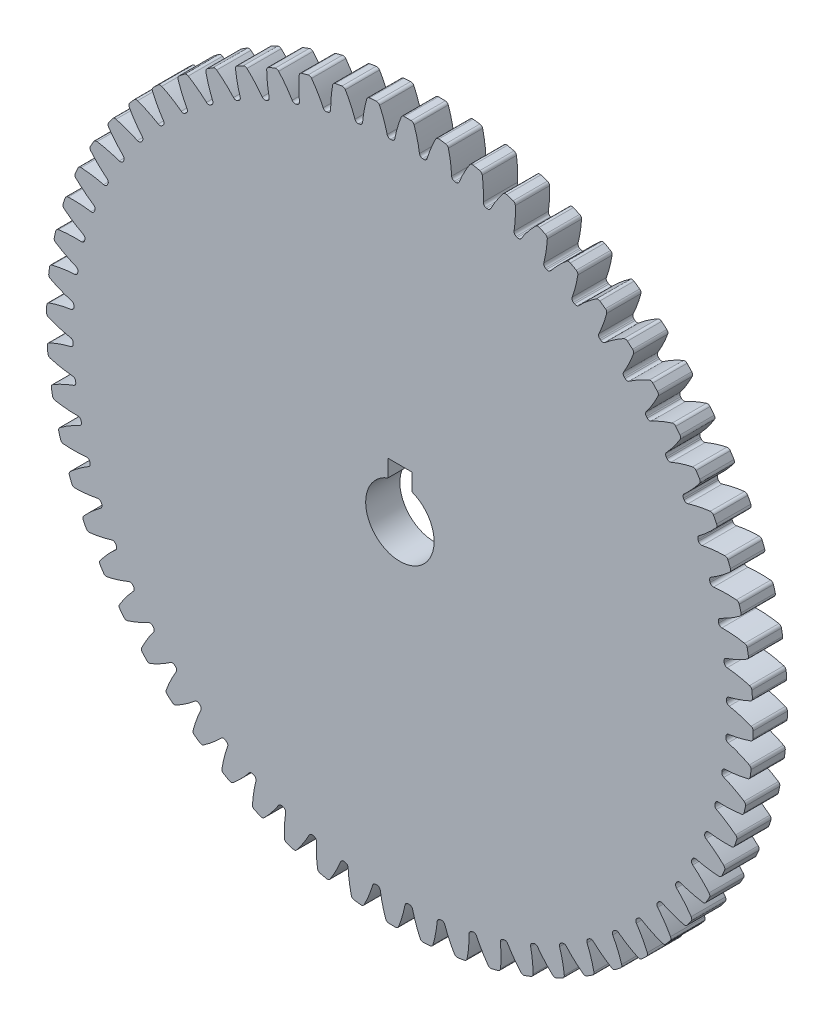
from build123d import *

# Parameters (mm, degrees)
SALIENTE_EXTRUIR1_DEPTH = 10
REDONDEO1_R             = 0.9525
MATRIZC1_DEPTH          = 10
CORTAR_EXTRUIR3_REACH   = 148.313


with BuildPart() as part:
    # Croquis2 → Saliente-Extruir1 (new body)
    with BuildSketch(Plane.XY):
        with BuildLine():
            ThreePointArc((-1.617609279, 95.459065591), (-2.108928891, -95.449475024), (5.832254015, 95.29446299))
            ThreePointArc((5.832254015, 95.29446299), (5.10661393, 99.278185867), (3.922472554, 103.150447571))
            ThreePointArc((3.922472554, 103.150447571), (2.2801704, 103.199813217), (0.637290554, 103.223032729))
            ThreePointArc((0.637290554, 103.223032729), (-0.716724786, 99.406850873), (-1.617609279, 95.459065591))
        make_face()
    extrude(amount=SALIENTE_EXTRUIR1_DEPTH)

    # Redondeo1
    redondeo1_edges = [part.edges().sort_by_distance(p)[0] for p in [
        (5.832254015, 95.29446299, 5),
        (-1.617609279, 95.459065591, 5),
        (0.637290554, 103.223032729, 5),
        (3.922472554, 103.150447571, 5),
    ]]
    fillet(redondeo1_edges, radius=REDONDEO1_R)

    # MatrizC1: read off the stored shape, not the designer's step
    # MatrizC1 outline → MatrizC1 (add)
    with BuildSketch(Plane.XY):
        with BuildLine():
            ThreePointArc((-10.905729372, 95.608172375), (-11.169760561, 95.031575012), (-11.737272301, 94.748542481))
            ThreePointArc((-11.737272301, 94.748542481), (-7.256910766, 95.196570892), (-2.760407872, 95.432856039))
            ThreePointArc((-2.760407872, 95.432856039), (-3.364264227, 95.626594242), (-3.712645561, 96.156506909))
            ThreePointArc((-3.712645561, 96.156506909), (-4.668126939, 99.355349151), (-5.926168915, 102.447737668))
            ThreePointArc((-5.926168915, 102.447737668), (-6.304598673, 102.866263261), (-6.853432254, 102.99723827))
            ThreePointArc((-6.853432254, 102.99723827), (-7.846159818, 102.926373691), (-8.838158, 102.845941039))
            ThreePointArc((-8.838158, 102.845941039), (-9.360796454, 102.633286859), (-9.671412988, 102.162234716))
            ThreePointArc((-9.671412988, 102.162234716), (-10.446171584, 98.914884185), (-10.905729372, 95.608172375))
        make_face()
        with BuildLine():
            ThreePointArc((6.972779758, 95.217804038), (11.45445841, 94.783148533), (15.910659207, 94.13766933))
            ThreePointArc((15.910659207, 94.13766933), (15.356202231, 94.445491439), (15.117895779, 95.033187809))
            ThreePointArc((15.117895779, 95.033187809), (14.804836871, 98.356970365), (14.17426289, 101.635371318))
            ThreePointArc((14.17426289, 101.635371318), (13.884754847, 102.119683042), (13.372018906, 102.355213523))
            ThreePointArc((13.372018906, 102.355213523), (12.38454133, 102.479382127), (11.395912483, 102.59402421))
            ThreePointArc((11.395912483, 102.59402421), (10.841829608, 102.487417825), (10.445283769, 102.086015097))
            ThreePointArc((10.445283769, 102.086015097), (9.051885281, 99.0522094), (7.956050296, 95.898690407))
            ThreePointArc((7.956050296, 95.898690407), (7.584603826, 95.38468213), (6.972779758, 95.217804038))
        make_face()
        with BuildLine():
            ThreePointArc((16.272180778, 94.075852353), (20.689675232, 93.204008508), (25.061150179, 92.124853405))
            ThreePointArc((25.061150179, 92.124853405), (24.539534908, 92.485539554), (24.359980284, 93.093764123))
            ThreePointArc((24.359980284, 93.093764123), (24.374216501, 96.432226895), (24.068018393, 99.75664851))
            ThreePointArc((24.068018393, 99.75664851), (23.827375261, 100.267004892), (23.340194307, 100.55165814))
            ThreePointArc((23.340194307, 100.55165814), (22.369642357, 100.772018566), (21.397010918, 100.983011189))
            ThreePointArc((21.397010918, 100.983011189), (20.835146851, 100.931227762), (20.40116614, 100.570626186))
            ThreePointArc((20.40116614, 100.570626186), (18.717112288, 97.688006028), (17.317455134, 94.657082702))
            ThreePointArc((17.317455134, 94.657082702), (16.89741566, 94.181957636), (16.272180778, 94.075852353))
        make_face()
        with BuildLine():
            ThreePointArc((25.414871801, 92.027898783), (29.725639171, 90.727262931), (33.970288574, 89.224824781))
            ThreePointArc((33.970288574, 89.224824781), (33.486538449, 89.634901366), (33.367464863, 90.257796597))
            ThreePointArc((33.367464863, 90.257796597), (33.708859103, 93.578788366), (33.729985722, 96.917214645))
            ThreePointArc((33.729985722, 96.917214645), (33.540525025, 97.448700673), (33.083590878, 97.779735322))
            ThreePointArc((33.083590878, 97.779735322), (32.1393115, 98.094165378), (31.19204444, 98.399476567))
            ThreePointArc((31.19204444, 98.399476567), (30.627810239, 98.4030148), (30.160574129, 98.086687168))
            ThreePointArc((30.160574129, 98.086687168), (28.202083272, 95.383013756), (26.512083413, 92.503875547))
            ThreePointArc((26.512083413, 92.503875547), (26.047496143, 92.072209406), (25.414871801, 92.027898783))
        make_face()
        with BuildLine():
            ThreePointArc((34.312803716, 89.09366624), (38.475328957, 87.376764215), (42.552274521, 85.465512319))
            ThreePointArc((42.552274521, 85.465512319), (42.111048319, 85.921030078), (42.053602514, 86.552597151))
            ThreePointArc((42.053602514, 86.552597151), (42.718866964, 89.82413495), (43.067114849, 93.144415023))
            ThreePointArc((43.067114849, 93.144415023), (42.930661198, 93.691912196), (42.508374384, 94.066140201))
            ThreePointArc((42.508374384, 94.066140201), (41.599461504, 94.471611755), (40.686681524, 94.868301195))
            ThreePointArc((40.686681524, 94.868301195), (40.125511072, 94.927127013), (39.629519301, 94.658119733))
            ThreePointArc((39.629519301, 94.658119733), (37.415452777, 92.15943092), (35.451385835, 89.459805502))
            ThreePointArc((35.451385835, 89.459805502), (34.946724999, 89.075755467), (34.312803716, 89.09366624))
        make_face()
        with BuildLine():
            ThreePointArc((42.880284574, 85.301412988), (46.854480291, 83.184779494), (50.724458803, 80.883120254))
            ThreePointArc((50.724458803, 80.883120254), (50.330005774, 81.379692301), (50.334740985, 82.013848879))
            ThreePointArc((50.334740985, 82.013848879), (51.317468783, 85.20442601), (51.989484118, 88.474583765))
            ThreePointArc((51.989484118, 88.474583765), (51.907351636, 89.032819387), (51.523779007, 89.446636728))
            ThreePointArc((51.523779007, 89.446636728), (50.658985953, 89.939244867), (49.789483623, 90.423492222))
            ThreePointArc((49.789483623, 90.423492222), (49.236781298, 90.537039101), (48.716810539, 90.317942859))
            ThreePointArc((48.716810539, 90.317942859), (46.268491018, 88.048302385), (44.049272032, 85.554188626))
            ThreePointArc((44.049272032, 85.554188626), (43.50939779, 85.221453309), (42.880284574, 85.301412988))
        make_face()
        with BuildLine():
            ThreePointArc((51.03480485, 80.687660499), (54.782397366, 78.191679875), (58.408138817, 75.521779525))
            ThreePointArc((58.408138817, 75.521779525), (58.06425776, 76.0546236), (58.131128383, 76.68526241))
            ThreePointArc((58.131128383, 76.68526241), (59.421855326, 79.764151871), (60.411166235, 82.952693902))
            ThreePointArc((60.411166235, 82.952693902), (60.384145902, 83.516291857), (60.042981472, 83.965713246))
            ThreePointArc((60.042981472, 83.965713246), (59.230636675, 84.540713885), (58.412785776, 85.107855588))
            ThreePointArc((58.412785776, 85.107855588), (57.873874405, 85.27503001), (57.33493226, 85.107954823))
            ThreePointArc((57.33493226, 85.107954823), (54.675938398, 83.089220566), (52.22293966, 80.824638145))
            ThreePointArc((52.22293966, 80.824638145), (51.653051295, 80.546421969), (51.03480485, 80.687660499))
        make_face()
        with BuildLine():
            ThreePointArc((58.697832057, 75.29684173), (62.182730008, 72.445551633), (65.529316526, 69.433122775))
            ThreePointArc((65.529316526, 69.433122775), (65.239319202, 69.997107299), (65.367681238, 70.618154943))
            ThreePointArc((65.367681238, 70.618154943), (66.953976918, 73.555705346), (68.251055796, 76.631924249))
            ThreePointArc((68.251055796, 76.631924249), (68.279407833, 77.195456782), (67.983937203, 77.676154046))
            ThreePointArc((67.983937203, 77.676154046), (67.231863986, 78.328009613), (66.473540871, 78.972583781))
            ThreePointArc((66.473540871, 78.972583781), (65.953610464, 79.191775763), (65.400887241, 79.078330657))
            ThreePointArc((65.400887241, 79.078330657), (62.556826603, 77.329944132), (59.89367183, 75.316702216))
            ThreePointArc((59.89367183, 75.316702216), (59.29925768, 75.095684555), (58.697832057, 75.29684173))
        make_face()
        with BuildLine():
            ThreePointArc((65.795567054, 69.180873215), (68.984208967, 66.001733127), (72.019411094, 62.675787097))
            ThreePointArc((72.019411094, 62.675787097), (71.786090337, 63.26548059), (71.974707589, 63.87095604))
            ThreePointArc((71.974707589, 63.87095604), (73.841295111, 66.638877169), (75.43365038, 69.573147274))
            ThreePointArc((75.43365038, 69.573147274), (75.517101742, 70.131187258), (75.270170455, 70.63853102))
            ThreePointArc((75.270170455, 70.63853102), (74.585611695, 71.360963791), (73.89411943, 72.076762821))
            ThreePointArc((73.89411943, 72.076762821), (73.398177201, 72.345861426), (72.836995926, 72.287138938))
            ThreePointArc((72.836995926, 72.287138938), (69.83525837, 70.825938063), (66.9875952, 69.083425272))
            ThreePointArc((66.9875952, 69.083425272), (66.374379797, 68.921734646), (65.795567054, 69.180873215))
        make_face()
        with BuildLine():
            ThreePointArc((72.259654772, 62.398655072), (75.121332283, 58.922281852), (77.815919363, 55.314849328))
            ThreePointArc((77.815919363, 55.314849328), (77.64152218, 55.924572719), (77.888578161, 56.508644915))
            ThreePointArc((77.888578161, 56.508644915), (80.017481267, 59.080280176), (81.889777675, 61.844342859))
            ThreePointArc((81.889777675, 61.844342859), (82.027524679, 62.391516064), (81.831510818, 62.920620326))
            ThreePointArc((81.831510818, 62.920620326), (81.22105919, 63.706672877), (80.603057223, 64.486803234))
            ThreePointArc((80.603057223, 64.486803234), (80.135879367, 64.803216894), (79.571644524, 64.799782555))
            ThreePointArc((79.571644524, 64.799782555), (76.441138423, 63.639839493), (73.436391409, 62.184837178))
            ThreePointArc((73.436391409, 62.184837178), (72.810280353, 62.084030757), (72.259654772, 62.398655072))
        make_face()
        with BuildLine():
            ThreePointArc((78.027842514, 55.01550377), (80.534996104, 51.275376791), (82.863017791, 47.421199321))
            ThreePointArc((82.863017791, 47.421199321), (82.749223721, 48.04508064), (83.052339146, 48.602124649))
            ThreePointArc((83.052339146, 48.602124649), (85.423055337, 50.952707788), (87.557261645, 53.519943615))
            ThreePointArc((87.557261645, 53.519943615), (87.747977713, 54.050980464), (87.604768999, 54.596749662))
            ThreePointArc((87.604768999, 54.596749662), (87.074303485, 55.438851878), (86.535743513, 56.275800479))
            ThreePointArc((86.535743513, 56.275800479), (86.101829209, 56.636481959), (85.539974686, 56.688368843))
            ThreePointArc((85.539974686, 56.688368843), (82.310848526, 55.840854479), (79.177955024, 54.687375108))
            ThreePointArc((79.177955024, 54.687375108), (78.544978107, 54.648423713), (78.027842514, 55.01550377))
        make_face()
        with BuildLine():
            ThreePointArc((83.044579479, 47.102523093), (85.173063887, 43.134661822), (87.11210006, 39.070857242))
            ThreePointArc((87.11210006, 39.070857242), (87.060005003, 39.702888171), (87.416260705, 40.227539353))
            ThreePointArc((87.416260705, 40.227539353), (90.005958686, 42.334432971), (92.381521322, 44.680118056))
            ThreePointArc((92.381521322, 44.680118056), (92.623369753, 45.189904374), (92.534345365, 45.747082453))
            ThreePointArc((92.534345365, 45.747082453), (92.088974638, 46.63712443), (91.635043289, 47.522831003))
            ThreePointArc((91.635043289, 47.522831003), (91.238571367, 47.924306742), (90.684508131, 48.03101515))
            ThreePointArc((90.684508131, 48.03101515), (87.387860162, 47.504091512), (84.156991649, 46.663243721))
            ThreePointArc((84.156991649, 46.663243721), (83.523244785, 46.686522474), (83.044579479, 47.102523093))
        make_face()
        with BuildLine():
            ThreePointArc((87.261551746, 38.735919369), (88.990868505, 34.57853648), (90.522245185, 30.344241449))
            ThreePointArc((90.522245185, 30.344241449), (90.532350844, 30.978335185), (90.938315886, 31.465540864))
            ThreePointArc((90.938315886, 31.465540864), (93.722055452, 33.308454422), (96.316096448, 35.409998536))
            ThreePointArc((96.316096448, 35.409998536), (96.60674811, 35.893624802), (96.5727654, 36.456845832))
            ThreePointArc((96.5727654, 36.456845832), (96.216778625, 37.386255978), (95.851847504, 38.312190685))
            ThreePointArc((95.851847504, 38.312190685), (95.496636207, 38.750594252), (94.95570019, 38.911096524))
            ThreePointArc((94.95570019, 38.911096524), (91.623278934, 38.709838174), (88.32555044, 38.189719787))
            ThreePointArc((88.32555044, 38.189719787), (87.697136957, 38.275004503), (87.261551746, 38.735919369))
        make_face()
        with BuildLine():
            ThreePointArc((90.638147567, 29.996267567), (91.951642412, 25.68940093), (93.060611604, 21.325394024))
            ThreePointArc((93.060611604, 21.325394024), (93.132820657, 21.955443897), (93.584585373, 22.400512014))
            ThreePointArc((93.584585373, 22.400512014), (96.535557589, 23.961697249), (99.323094914, 25.798861373))
            ThreePointArc((99.323094914, 25.798861373), (99.659750672, 26.251670001), (99.681136912, 26.815509856))
            ThreePointArc((99.681136912, 26.815509856), (99.417962436, 27.775337444), (99.14554603, 28.732583027))
            ThreePointArc((99.14554603, 28.732583027), (98.835016237, 29.203692357), (98.312416948, 29.416442768))
            ThreePointArc((98.312416948, 29.416442768), (94.976315443, 29.542787934), (91.643485897, 29.348407976))
            ThreePointArc((91.643485897, 29.348407976), (91.02645776, 29.494877315), (90.638147567, 29.996267567))
        make_face()
        with BuildLine():
            ThreePointArc((93.14184848, 20.967735311), (94.026871737, 16.552862404), (94.702753462, 12.101171395))
            ThreePointArc((94.702753462, 12.101171395), (94.836370495, 12.721109682), (95.329584145, 13.119753989))
            ThreePointArc((95.329584145, 13.119753989), (98.419369535, 14.384175832), (101.373557679, 15.939267072))
            ThreePointArc((101.373557679, 15.939267072), (101.752975355, 16.356897268), (101.829524585, 16.915925862))
            ThreePointArc((101.829524585, 16.915925862), (101.661696921, 17.896927227), (101.484418749, 18.876264888))
            ThreePointArc((101.484418749, 18.876264888), (101.221561031, 19.375542941), (100.722331388, 19.638492588))
            ThreePointArc((100.722331388, 19.638492588), (97.414678115, 20.091224497), (94.078844486, 20.224454953))
            ThreePointArc((94.078844486, 20.224454953), (93.479144014, 20.430698335), (93.14184848, 20.967735311))
        make_face()
        with BuildLine():
            ThreePointArc((94.748542476, 11.7372723), (95.196570886, 7.256910765), (95.432856033, 2.760407872))
            ThreePointArc((95.432856033, 2.760407872), (95.626594242, 3.364264227), (96.156506909, 3.712645561))
            ThreePointArc((96.156506909, 3.712645561), (99.355349151, 4.668126939), (102.447737668, 5.926168915))
            ThreePointArc((102.447737668, 5.926168915), (102.866263261, 6.304598673), (102.99723827, 6.853432254))
            ThreePointArc((102.99723827, 6.853432254), (102.926373691, 7.846159818), (102.845941039, 8.838158))
            ThreePointArc((102.845941039, 8.838158), (102.633286859, 9.360796454), (102.162234716, 9.671412988))
            ThreePointArc((102.162234716, 9.671412988), (98.914884185, 10.446171584), (95.608172375, 10.905729372))
            ThreePointArc((95.608172375, 10.905729372), (95.031575012, 11.169760561), (94.748542476, 11.7372723))
        make_face()
        with BuildLine():
            ThreePointArc((95.442756212, 2.393772943), (95.449475018, -2.108928891), (95.243888033, -6.606939889))
            ThreePointArc((95.243888033, -6.606939889), (95.495881612, -6.024980932), (96.057389947, -5.730217673))
            ThreePointArc((96.057389947, -5.730217673), (99.334482442, -5.092878568), (102.53528994, -4.144001487))
            ThreePointArc((102.53528994, -4.144001487), (102.98889282, -3.808416654), (103.173032247, -3.275063652))
            ThreePointArc((103.173032247, -3.275063652), (103.199813217, -2.2801704), (103.217000695, -1.285065182))
            ThreePointArc((103.217000695, -1.285065182), (103.05659803, -0.744099621), (102.618259876, -0.388807605))
            ThreePointArc((102.618259876, -0.388807605), (99.462485847, 0.700516329), (96.216741299, 1.481975656))
            ThreePointArc((96.216741299, 1.481975656), (95.668799992, 1.801251888), (95.442756212, 2.393772943))
        make_face()
        with BuildLine():
            ThreePointArc((95.217804033, -6.972779758), (94.783148528, -11.454458409), (94.137669325, -15.910659206))
            ThreePointArc((94.137669325, -15.910659206), (94.445491439, -15.356202231), (95.033187809, -15.117895779))
            ThreePointArc((95.033187809, -15.117895779), (98.356970365, -14.804836871), (101.635371318, -14.17426289))
            ThreePointArc((101.635371318, -14.17426289), (102.119683042, -13.884754847), (102.355213523, -13.372018906))
            ThreePointArc((102.355213523, -13.372018906), (102.479382127, -12.38454133), (102.59402421, -11.395912483))
            ThreePointArc((102.59402421, -11.395912483), (102.487417825, -10.841829608), (102.086015097, -10.445283769))
            ThreePointArc((102.086015097, -10.445283769), (99.0522094, -9.051885281), (95.898690407, -7.956050296))
            ThreePointArc((95.898690407, -7.956050296), (95.38468213, -7.584603826), (95.217804033, -6.972779758))
        make_face()
        with BuildLine():
            ThreePointArc((94.075852349, -16.272180777), (93.204008504, -20.689675231), (92.124853401, -25.061150178))
            ThreePointArc((92.124853401, -25.061150178), (92.485539554, -24.539534908), (93.093764123, -24.359980284))
            ThreePointArc((93.093764123, -24.359980284), (96.432226895, -24.374216501), (99.75664851, -24.068018393))
            ThreePointArc((99.75664851, -24.068018393), (100.267004892, -23.827375261), (100.55165814, -23.340194307))
            ThreePointArc((100.55165814, -23.340194307), (100.772018566, -22.369642357), (100.983011189, -21.397010918))
            ThreePointArc((100.983011189, -21.397010918), (100.931227762, -20.835146851), (100.570626186, -20.40116614))
            ThreePointArc((100.570626186, -20.40116614), (97.688006028, -18.717112288), (94.657082702, -17.317455134))
            ThreePointArc((94.657082702, -17.317455134), (94.181957636, -16.89741566), (94.075852349, -16.272180777))
        make_face()
        with BuildLine():
            ThreePointArc((92.02789878, -25.4148718), (90.727262927, -29.72563917), (89.224824778, -33.970288573))
            ThreePointArc((89.224824778, -33.970288573), (89.634901366, -33.486538449), (90.257796597, -33.367464863))
            ThreePointArc((90.257796597, -33.367464863), (93.578788366, -33.708859103), (96.917214645, -33.729985722))
            ThreePointArc((96.917214645, -33.729985722), (97.448700673, -33.540525025), (97.779735322, -33.083590878))
            ThreePointArc((97.779735322, -33.083590878), (98.094165378, -32.1393115), (98.399476567, -31.19204444))
            ThreePointArc((98.399476567, -31.19204444), (98.4030148, -30.627810239), (98.086687168, -30.160574129))
            ThreePointArc((98.086687168, -30.160574129), (95.383013756, -28.202083272), (92.503875547, -26.512083413))
            ThreePointArc((92.503875547, -26.512083413), (92.072209406, -26.047496143), (92.02789878, -25.4148718))
        make_face()
        with BuildLine():
            ThreePointArc((89.093666237, -34.312803715), (87.376764212, -38.475328955), (85.465512317, -42.55227452))
            ThreePointArc((85.465512317, -42.55227452), (85.921030078, -42.111048319), (86.552597151, -42.053602514))
            ThreePointArc((86.552597151, -42.053602514), (89.82413495, -42.718866964), (93.144415023, -43.067114849))
            ThreePointArc((93.144415023, -43.067114849), (93.691912196, -42.930661198), (94.066140201, -42.508374384))
            ThreePointArc((94.066140201, -42.508374384), (94.471611755, -41.599461504), (94.868301195, -40.686681524))
            ThreePointArc((94.868301195, -40.686681524), (94.927127013, -40.125511072), (94.658119733, -39.629519301))
            ThreePointArc((94.658119733, -39.629519301), (92.15943092, -37.415452777), (89.459805502, -35.451385835))
            ThreePointArc((89.459805502, -35.451385835), (89.075755467, -34.946724999), (89.093666237, -34.312803715))
        make_face()
        with BuildLine():
            ThreePointArc((85.301412986, -42.880284573), (83.184779493, -46.85448029), (80.883120252, -50.724458802))
            ThreePointArc((80.883120252, -50.724458802), (81.379692301, -50.330005774), (82.013848879, -50.334740985))
            ThreePointArc((82.013848879, -50.334740985), (85.20442601, -51.317468783), (88.474583765, -51.989484118))
            ThreePointArc((88.474583765, -51.989484118), (89.032819387, -51.907351636), (89.446636728, -51.523779007))
            ThreePointArc((89.446636728, -51.523779007), (89.939244867, -50.658985953), (90.423492222, -49.789483623))
            ThreePointArc((90.423492222, -49.789483623), (90.537039101, -49.236781298), (90.317942859, -48.716810539))
            ThreePointArc((90.317942859, -48.716810539), (88.048302385, -46.268491018), (85.554188626, -44.049272032))
            ThreePointArc((85.554188626, -44.049272032), (85.221453309, -43.50939779), (85.301412986, -42.880284573))
        make_face()
        with BuildLine():
            ThreePointArc((80.687660497, -51.034804849), (78.191679874, -54.782397365), (75.521779525, -58.408138816))
            ThreePointArc((75.521779525, -58.408138816), (76.0546236, -58.06425776), (76.68526241, -58.131128383))
            ThreePointArc((76.68526241, -58.131128383), (79.764151871, -59.421855326), (82.952693902, -60.411166235))
            ThreePointArc((82.952693902, -60.411166235), (83.516291857, -60.384145902), (83.965713246, -60.042981472))
            ThreePointArc((83.965713246, -60.042981472), (84.540713885, -59.230636675), (85.107855588, -58.412785776))
            ThreePointArc((85.107855588, -58.412785776), (85.27503001, -57.873874405), (85.107954823, -57.33493226))
            ThreePointArc((85.107954823, -57.33493226), (83.089220566, -54.675938398), (80.824638145, -52.22293966))
            ThreePointArc((80.824638145, -52.22293966), (80.546421969, -51.653051295), (80.687660497, -51.034804849))
        make_face()
        with BuildLine():
            ThreePointArc((75.29684173, -58.697832056), (72.445551633, -62.182730007), (69.433122775, -65.529316525))
            ThreePointArc((69.433122775, -65.529316525), (69.997107299, -65.239319202), (70.618154943, -65.367681238))
            ThreePointArc((70.618154943, -65.367681238), (73.555705346, -66.953976918), (76.631924249, -68.251055796))
            ThreePointArc((76.631924249, -68.251055796), (77.195456782, -68.279407833), (77.676154046, -67.983937203))
            ThreePointArc((77.676154046, -67.983937203), (78.328009613, -67.231863986), (78.972583781, -66.473540871))
            ThreePointArc((78.972583781, -66.473540871), (79.191775763, -65.953610464), (79.078330657, -65.400887241))
            ThreePointArc((79.078330657, -65.400887241), (77.329944132, -62.556826603), (75.316702216, -59.89367183))
            ThreePointArc((75.316702216, -59.89367183), (75.095684555, -59.29925768), (75.29684173, -58.697832056))
        make_face()
        with BuildLine():
            ThreePointArc((69.180873215, -65.795567054), (66.001733128, -68.984208967), (62.675787098, -72.019411094))
            ThreePointArc((62.675787098, -72.019411094), (63.26548059, -71.786090337), (63.87095604, -71.974707589))
            ThreePointArc((63.87095604, -71.974707589), (66.638877169, -73.841295111), (69.573147274, -75.43365038))
            ThreePointArc((69.573147274, -75.43365038), (70.131187258, -75.517101742), (70.63853102, -75.270170455))
            ThreePointArc((70.63853102, -75.270170455), (71.360963791, -74.585611695), (72.076762821, -73.89411943))
            ThreePointArc((72.076762821, -73.89411943), (72.345861426, -73.398177201), (72.287138938, -72.836995926))
            ThreePointArc((72.287138938, -72.836995926), (70.825938063, -69.83525837), (69.083425272, -66.9875952))
            ThreePointArc((69.083425272, -66.9875952), (68.921734646, -66.374379797), (69.180873215, -65.795567054))
        make_face()
        with BuildLine():
            ThreePointArc((62.398655073, -72.259654772), (58.922281852, -75.121332284), (55.314849329, -77.815919364))
            ThreePointArc((55.314849329, -77.815919364), (55.924572719, -77.64152218), (56.508644915, -77.888578161))
            ThreePointArc((56.508644915, -77.888578161), (59.080280176, -80.017481267), (61.844342859, -81.889777675))
            ThreePointArc((61.844342859, -81.889777675), (62.391516064, -82.027524679), (62.920620326, -81.831510818))
            ThreePointArc((62.920620326, -81.831510818), (63.706672877, -81.22105919), (64.486803234, -80.603057223))
            ThreePointArc((64.486803234, -80.603057223), (64.803216894, -80.135879367), (64.799782555, -79.571644524))
            ThreePointArc((64.799782555, -79.571644524), (63.639839493, -76.441138423), (62.184837178, -73.436391409))
            ThreePointArc((62.184837178, -73.436391409), (62.084030757, -72.810280353), (62.398655073, -72.259654772))
        make_face()
        with BuildLine():
            ThreePointArc((55.015503771, -78.027842515), (51.275376792, -80.534996105), (47.421199323, -82.863017793))
            ThreePointArc((47.421199323, -82.863017793), (48.04508064, -82.749223721), (48.602124649, -83.052339146))
            ThreePointArc((48.602124649, -83.052339146), (50.952707788, -85.423055337), (53.519943615, -87.557261645))
            ThreePointArc((53.519943615, -87.557261645), (54.050980464, -87.747977713), (54.596749662, -87.604768999))
            ThreePointArc((54.596749662, -87.604768999), (55.438851878, -87.074303485), (56.275800479, -86.535743513))
            ThreePointArc((56.275800479, -86.535743513), (56.636481959, -86.101829209), (56.688368843, -85.539974686))
            ThreePointArc((56.688368843, -85.539974686), (55.840854479, -82.310848526), (54.687375108, -79.177955024))
            ThreePointArc((54.687375108, -79.177955024), (54.648423713, -78.544978107), (55.015503771, -78.027842515))
        make_face()
        with BuildLine():
            ThreePointArc((47.102523094, -83.044579481), (43.134661823, -85.17306389), (39.070857243, -87.112100062))
            ThreePointArc((39.070857243, -87.112100062), (39.702888171, -87.060005003), (40.227539353, -87.416260705))
            ThreePointArc((40.227539353, -87.416260705), (42.334432971, -90.005958686), (44.680118056, -92.381521322))
            ThreePointArc((44.680118056, -92.381521322), (45.189904374, -92.623369753), (45.747082453, -92.534345365))
            ThreePointArc((45.747082453, -92.534345365), (46.63712443, -92.088974638), (47.522831003, -91.635043289))
            ThreePointArc((47.522831003, -91.635043289), (47.924306742, -91.238571367), (48.03101515, -90.684508131))
            ThreePointArc((48.03101515, -90.684508131), (47.504091512, -87.387860162), (46.663243721, -84.156991649))
            ThreePointArc((46.663243721, -84.156991649), (46.686522474, -83.523244785), (47.102523094, -83.044579481))
        make_face()
        with BuildLine():
            ThreePointArc((38.73591937, -87.261551748), (34.578536481, -88.990868508), (30.34424145, -90.522245188))
            ThreePointArc((30.34424145, -90.522245188), (30.978335185, -90.532350844), (31.465540864, -90.938315886))
            ThreePointArc((31.465540864, -90.938315886), (33.308454422, -93.722055452), (35.409998536, -96.316096448))
            ThreePointArc((35.409998536, -96.316096448), (35.893624802, -96.60674811), (36.456845832, -96.5727654))
            ThreePointArc((36.456845832, -96.5727654), (37.386255978, -96.216778625), (38.312190685, -95.851847504))
            ThreePointArc((38.312190685, -95.851847504), (38.750594252, -95.496636207), (38.911096524, -94.95570019))
            ThreePointArc((38.911096524, -94.95570019), (38.709838174, -91.623278934), (38.189719787, -88.32555044))
            ThreePointArc((38.189719787, -88.32555044), (38.275004503, -87.697136957), (38.73591937, -87.261551748))
        make_face()
        with BuildLine():
            ThreePointArc((29.996267569, -90.638147571), (25.689400931, -91.951642416), (21.325394025, -93.060611608))
            ThreePointArc((21.325394025, -93.060611608), (21.955443897, -93.132820657), (22.400512014, -93.584585373))
            ThreePointArc((22.400512014, -93.584585373), (23.961697249, -96.535557589), (25.798861373, -99.323094914))
            ThreePointArc((25.798861373, -99.323094914), (26.251670001, -99.659750672), (26.815509856, -99.681136912))
            ThreePointArc((26.815509856, -99.681136912), (27.775337444, -99.417962436), (28.732583027, -99.14554603))
            ThreePointArc((28.732583027, -99.14554603), (29.203692357, -98.835016237), (29.416442768, -98.312416948))
            ThreePointArc((29.416442768, -98.312416948), (29.542787934, -94.976315443), (29.348407976, -91.643485897))
            ThreePointArc((29.348407976, -91.643485897), (29.494877315, -91.02645776), (29.996267569, -90.638147571))
        make_face()
        with BuildLine():
            ThreePointArc((20.967735312, -93.141848484), (16.552862405, -94.026871741), (12.101171396, -94.702753466))
            ThreePointArc((12.101171396, -94.702753466), (12.721109682, -94.836370495), (13.119753989, -95.329584145))
            ThreePointArc((13.119753989, -95.329584145), (14.384175832, -98.419369535), (15.939267072, -101.373557679))
            ThreePointArc((15.939267072, -101.373557679), (16.356897268, -101.752975355), (16.915925862, -101.829524585))
            ThreePointArc((16.915925862, -101.829524585), (17.896927227, -101.661696921), (18.876264888, -101.484418749))
            ThreePointArc((18.876264888, -101.484418749), (19.375542941, -101.221561031), (19.638492588, -100.722331388))
            ThreePointArc((19.638492588, -100.722331388), (20.091224497, -97.414678115), (20.224454953, -94.078844486))
            ThreePointArc((20.224454953, -94.078844486), (20.430698335, -93.479144014), (20.967735312, -93.141848484))
        make_face()
        with BuildLine():
            ThreePointArc((11.737272301, -94.748542481), (7.256910766, -95.196570891), (2.760407872, -95.432856039))
            ThreePointArc((2.760407872, -95.432856039), (3.364264227, -95.626594242), (3.712645561, -96.156506909))
            ThreePointArc((3.712645561, -96.156506909), (4.668126939, -99.355349151), (5.926168915, -102.447737668))
            ThreePointArc((5.926168915, -102.447737668), (6.304598673, -102.866263261), (6.853432254, -102.99723827))
            ThreePointArc((6.853432254, -102.99723827), (7.846159818, -102.926373691), (8.838158, -102.845941039))
            ThreePointArc((8.838158, -102.845941039), (9.360796454, -102.633286859), (9.671412988, -102.162234716))
            ThreePointArc((9.671412988, -102.162234716), (10.446171584, -98.914884185), (10.905729372, -95.608172375))
            ThreePointArc((10.905729372, -95.608172375), (11.169760561, -95.031575012), (11.737272301, -94.748542481))
        make_face()
        with BuildLine():
            ThreePointArc((2.393772943, -95.442756218), (-2.108928891, -95.449475024), (-6.606939889, -95.243888039))
            ThreePointArc((-6.606939889, -95.243888039), (-6.024980932, -95.495881612), (-5.730217673, -96.057389947))
            ThreePointArc((-5.730217673, -96.057389947), (-5.092878568, -99.334482442), (-4.144001487, -102.53528994))
            ThreePointArc((-4.144001487, -102.53528994), (-3.808416654, -102.98889282), (-3.275063652, -103.173032247))
            ThreePointArc((-3.275063652, -103.173032247), (-2.2801704, -103.199813217), (-1.285065182, -103.217000695))
            ThreePointArc((-1.285065182, -103.217000695), (-0.744099621, -103.05659803), (-0.388807605, -102.618259876))
            ThreePointArc((-0.388807605, -102.618259876), (0.700516329, -99.462485847), (1.481975656, -96.216741299))
            ThreePointArc((1.481975656, -96.216741299), (1.801251888, -95.668799992), (2.393772943, -95.442756218))
        make_face()
        with BuildLine():
            ThreePointArc((-6.972779758, -95.217804039), (-11.45445841, -94.783148534), (-15.910659207, -94.137669332))
            ThreePointArc((-15.910659207, -94.137669332), (-15.356202231, -94.445491439), (-15.117895779, -95.033187809))
            ThreePointArc((-15.117895779, -95.033187809), (-14.804836871, -98.356970365), (-14.17426289, -101.635371318))
            ThreePointArc((-14.17426289, -101.635371318), (-13.884754847, -102.119683042), (-13.372018906, -102.355213523))
            ThreePointArc((-13.372018906, -102.355213523), (-12.38454133, -102.479382127), (-11.395912483, -102.59402421))
            ThreePointArc((-11.395912483, -102.59402421), (-10.841829608, -102.487417825), (-10.445283769, -102.086015097))
            ThreePointArc((-10.445283769, -102.086015097), (-9.051885281, -99.0522094), (-7.956050296, -95.898690407))
            ThreePointArc((-7.956050296, -95.898690407), (-7.584603826, -95.38468213), (-6.972779758, -95.217804039))
        make_face()
        with BuildLine():
            ThreePointArc((-16.272180778, -94.075852355), (-20.689675233, -93.20400851), (-25.061150179, -92.124853408))
            ThreePointArc((-25.061150179, -92.124853408), (-24.539534908, -92.485539554), (-24.359980284, -93.093764123))
            ThreePointArc((-24.359980284, -93.093764123), (-24.374216501, -96.432226895), (-24.068018393, -99.75664851))
            ThreePointArc((-24.068018393, -99.75664851), (-23.827375261, -100.267004892), (-23.340194307, -100.55165814))
            ThreePointArc((-23.340194307, -100.55165814), (-22.369642357, -100.772018566), (-21.397010918, -100.983011189))
            ThreePointArc((-21.397010918, -100.983011189), (-20.835146851, -100.931227762), (-20.40116614, -100.570626186))
            ThreePointArc((-20.40116614, -100.570626186), (-18.717112288, -97.688006028), (-17.317455134, -94.657082702))
            ThreePointArc((-17.317455134, -94.657082702), (-16.89741566, -94.181957636), (-16.272180778, -94.075852355))
        make_face()
        with BuildLine():
            ThreePointArc((-25.414871801, -92.027898786), (-29.725639173, -90.727262934), (-33.970288576, -89.224824785))
            ThreePointArc((-33.970288576, -89.224824785), (-33.486538449, -89.634901366), (-33.367464863, -90.257796597))
            ThreePointArc((-33.367464863, -90.257796597), (-33.708859103, -93.578788366), (-33.729985722, -96.917214645))
            ThreePointArc((-33.729985722, -96.917214645), (-33.540525025, -97.448700673), (-33.083590878, -97.779735322))
            ThreePointArc((-33.083590878, -97.779735322), (-32.1393115, -98.094165378), (-31.19204444, -98.399476567))
            ThreePointArc((-31.19204444, -98.399476567), (-30.627810239, -98.4030148), (-30.160574129, -98.086687168))
            ThreePointArc((-30.160574129, -98.086687168), (-28.202083272, -95.383013756), (-26.512083413, -92.503875547))
            ThreePointArc((-26.512083413, -92.503875547), (-26.047496143, -92.072209406), (-25.414871801, -92.027898786))
        make_face()
        with BuildLine():
            ThreePointArc((-34.312803718, -89.093666244), (-38.475328958, -87.376764219), (-42.552274523, -85.465512324))
            ThreePointArc((-42.552274523, -85.465512324), (-42.111048319, -85.921030078), (-42.053602514, -86.552597151))
            ThreePointArc((-42.053602514, -86.552597151), (-42.718866964, -89.82413495), (-43.067114849, -93.144415023))
            ThreePointArc((-43.067114849, -93.144415023), (-42.930661198, -93.691912196), (-42.508374384, -94.066140201))
            ThreePointArc((-42.508374384, -94.066140201), (-41.599461504, -94.471611755), (-40.686681524, -94.868301195))
            ThreePointArc((-40.686681524, -94.868301195), (-40.125511072, -94.927127013), (-39.629519301, -94.658119733))
            ThreePointArc((-39.629519301, -94.658119733), (-37.415452777, -92.15943092), (-35.451385835, -89.459805502))
            ThreePointArc((-35.451385835, -89.459805502), (-34.946724999, -89.075755467), (-34.312803718, -89.093666244))
        make_face()
        with BuildLine():
            ThreePointArc((-42.880284576, -85.301412993), (-46.854480293, -83.184779499), (-50.724458806, -80.883120259))
            ThreePointArc((-50.724458806, -80.883120259), (-50.330005774, -81.379692301), (-50.334740985, -82.013848879))
            ThreePointArc((-50.334740985, -82.013848879), (-51.317468783, -85.20442601), (-51.989484118, -88.474583765))
            ThreePointArc((-51.989484118, -88.474583765), (-51.907351636, -89.032819387), (-51.523779007, -89.446636728))
            ThreePointArc((-51.523779007, -89.446636728), (-50.658985953, -89.939244867), (-49.789483623, -90.423492222))
            ThreePointArc((-49.789483623, -90.423492222), (-49.236781298, -90.537039101), (-48.716810539, -90.317942859))
            ThreePointArc((-48.716810539, -90.317942859), (-46.268491018, -88.048302385), (-44.049272032, -85.554188626))
            ThreePointArc((-44.049272032, -85.554188626), (-43.50939779, -85.221453309), (-42.880284576, -85.301412993))
        make_face()
        with BuildLine():
            ThreePointArc((-51.034804853, -80.687660504), (-54.78239737, -78.19167988), (-58.408138821, -75.521779531))
            ThreePointArc((-58.408138821, -75.521779531), (-58.06425776, -76.0546236), (-58.131128383, -76.68526241))
            ThreePointArc((-58.131128383, -76.68526241), (-59.421855326, -79.764151871), (-60.411166235, -82.952693902))
            ThreePointArc((-60.411166235, -82.952693902), (-60.384145902, -83.516291857), (-60.042981472, -83.965713246))
            ThreePointArc((-60.042981472, -83.965713246), (-59.230636675, -84.540713885), (-58.412785776, -85.107855588))
            ThreePointArc((-58.412785776, -85.107855588), (-57.873874405, -85.27503001), (-57.33493226, -85.107954823))
            ThreePointArc((-57.33493226, -85.107954823), (-54.675938398, -83.089220566), (-52.22293966, -80.824638145))
            ThreePointArc((-52.22293966, -80.824638145), (-51.653051295, -80.546421969), (-51.034804853, -80.687660504))
        make_face()
        with BuildLine():
            ThreePointArc((-58.697832061, -75.296841736), (-62.182730013, -72.445551639), (-65.529316531, -69.433122781))
            ThreePointArc((-65.529316531, -69.433122781), (-65.239319202, -69.997107299), (-65.367681238, -70.618154943))
            ThreePointArc((-65.367681238, -70.618154943), (-66.953976918, -73.555705346), (-68.251055796, -76.631924249))
            ThreePointArc((-68.251055796, -76.631924249), (-68.279407833, -77.195456782), (-67.983937203, -77.676154046))
            ThreePointArc((-67.983937203, -77.676154046), (-67.231863986, -78.328009613), (-66.473540871, -78.972583781))
            ThreePointArc((-66.473540871, -78.972583781), (-65.953610464, -79.191775763), (-65.400887241, -79.078330657))
            ThreePointArc((-65.400887241, -79.078330657), (-62.556826603, -77.329944132), (-59.89367183, -75.316702216))
            ThreePointArc((-59.89367183, -75.316702216), (-59.29925768, -75.095684555), (-58.697832061, -75.296841736))
        make_face()
        with BuildLine():
            ThreePointArc((-65.795567059, -69.18087322), (-68.984208973, -66.001733133), (-72.0194111, -62.675787103))
            ThreePointArc((-72.0194111, -62.675787103), (-71.786090337, -63.26548059), (-71.974707589, -63.87095604))
            ThreePointArc((-71.974707589, -63.87095604), (-73.841295111, -66.638877169), (-75.43365038, -69.573147274))
            ThreePointArc((-75.43365038, -69.573147274), (-75.517101742, -70.131187258), (-75.270170455, -70.63853102))
            ThreePointArc((-75.270170455, -70.63853102), (-74.585611695, -71.360963791), (-73.89411943, -72.076762821))
            ThreePointArc((-73.89411943, -72.076762821), (-73.398177201, -72.345861426), (-72.836995926, -72.287138938))
            ThreePointArc((-72.836995926, -72.287138938), (-69.83525837, -70.825938063), (-66.9875952, -69.083425272))
            ThreePointArc((-66.9875952, -69.083425272), (-66.374379797, -68.921734646), (-65.795567059, -69.18087322))
        make_face()
        with BuildLine():
            ThreePointArc((-72.259654778, -62.398655078), (-75.12133229, -58.922281857), (-77.81591937, -55.314849333))
            ThreePointArc((-77.81591937, -55.314849333), (-77.64152218, -55.924572719), (-77.888578161, -56.508644915))
            ThreePointArc((-77.888578161, -56.508644915), (-80.017481267, -59.080280176), (-81.889777675, -61.844342859))
            ThreePointArc((-81.889777675, -61.844342859), (-82.027524679, -62.391516064), (-81.831510818, -62.920620326))
            ThreePointArc((-81.831510818, -62.920620326), (-81.22105919, -63.706672877), (-80.603057223, -64.486803234))
            ThreePointArc((-80.603057223, -64.486803234), (-80.135879367, -64.803216894), (-79.571644524, -64.799782555))
            ThreePointArc((-79.571644524, -64.799782555), (-76.441138423, -63.639839493), (-73.436391409, -62.184837178))
            ThreePointArc((-73.436391409, -62.184837178), (-72.810280353, -62.084030757), (-72.259654778, -62.398655078))
        make_face()
        with BuildLine():
            ThreePointArc((-78.027842522, -55.015503776), (-80.534996112, -51.275376796), (-82.863017799, -47.421199326))
            ThreePointArc((-82.863017799, -47.421199326), (-82.749223721, -48.04508064), (-83.052339146, -48.602124649))
            ThreePointArc((-83.052339146, -48.602124649), (-85.423055337, -50.952707788), (-87.557261645, -53.519943615))
            ThreePointArc((-87.557261645, -53.519943615), (-87.747977713, -54.050980464), (-87.604768999, -54.596749662))
            ThreePointArc((-87.604768999, -54.596749662), (-87.074303485, -55.438851878), (-86.535743513, -56.275800479))
            ThreePointArc((-86.535743513, -56.275800479), (-86.101829209, -56.636481959), (-85.539974686, -56.688368843))
            ThreePointArc((-85.539974686, -56.688368843), (-82.310848526, -55.840854479), (-79.177955024, -54.687375108))
            ThreePointArc((-79.177955024, -54.687375108), (-78.544978107, -54.648423713), (-78.027842522, -55.015503776))
        make_face()
        with BuildLine():
            ThreePointArc((-83.044579487, -47.102523097), (-85.173063896, -43.134661826), (-87.112100069, -39.070857246))
            ThreePointArc((-87.112100069, -39.070857246), (-87.060005003, -39.702888171), (-87.416260705, -40.227539353))
            ThreePointArc((-87.416260705, -40.227539353), (-90.005958686, -42.334432971), (-92.381521322, -44.680118056))
            ThreePointArc((-92.381521322, -44.680118056), (-92.623369753, -45.189904374), (-92.534345365, -45.747082453))
            ThreePointArc((-92.534345365, -45.747082453), (-92.088974638, -46.63712443), (-91.635043289, -47.522831003))
            ThreePointArc((-91.635043289, -47.522831003), (-91.238571367, -47.924306742), (-90.684508131, -48.03101515))
            ThreePointArc((-90.684508131, -48.03101515), (-87.387860162, -47.504091512), (-84.156991649, -46.663243721))
            ThreePointArc((-84.156991649, -46.663243721), (-83.523244785, -46.686522474), (-83.044579487, -47.102523097))
        make_face()
        with BuildLine():
            ThreePointArc((-87.261551755, -38.735919373), (-88.990868515, -34.578536484), (-90.522245195, -30.344241453))
            ThreePointArc((-90.522245195, -30.344241453), (-90.532350844, -30.978335185), (-90.938315886, -31.465540864))
            ThreePointArc((-90.938315886, -31.465540864), (-93.722055452, -33.308454422), (-96.316096448, -35.409998536))
            ThreePointArc((-96.316096448, -35.409998536), (-96.60674811, -35.893624802), (-96.5727654, -36.456845832))
            ThreePointArc((-96.5727654, -36.456845832), (-96.216778625, -37.386255978), (-95.851847504, -38.312190685))
            ThreePointArc((-95.851847504, -38.312190685), (-95.496636207, -38.750594252), (-94.95570019, -38.911096524))
            ThreePointArc((-94.95570019, -38.911096524), (-91.623278934, -38.709838174), (-88.32555044, -38.189719787))
            ThreePointArc((-88.32555044, -38.189719787), (-87.697136957, -38.275004503), (-87.261551755, -38.735919373))
        make_face()
        with BuildLine():
            ThreePointArc((-90.638147577, -29.996267571), (-91.951642422, -25.689400932), (-93.060611614, -21.325394026))
            ThreePointArc((-93.060611614, -21.325394026), (-93.132820657, -21.955443897), (-93.584585373, -22.400512014))
            ThreePointArc((-93.584585373, -22.400512014), (-96.535557589, -23.961697249), (-99.323094914, -25.798861373))
            ThreePointArc((-99.323094914, -25.798861373), (-99.659750672, -26.251670001), (-99.681136912, -26.815509856))
            ThreePointArc((-99.681136912, -26.815509856), (-99.417962436, -27.775337444), (-99.14554603, -28.732583027))
            ThreePointArc((-99.14554603, -28.732583027), (-98.835016237, -29.203692357), (-98.312416948, -29.416442768))
            ThreePointArc((-98.312416948, -29.416442768), (-94.976315443, -29.542787934), (-91.643485897, -29.348407976))
            ThreePointArc((-91.643485897, -29.348407976), (-91.02645776, -29.494877315), (-90.638147577, -29.996267571))
        make_face()
        with BuildLine():
            ThreePointArc((-93.141848491, -20.967735313), (-94.026871747, -16.552862406), (-94.702753472, -12.101171397))
            ThreePointArc((-94.702753472, -12.101171397), (-94.836370495, -12.721109682), (-95.329584145, -13.119753989))
            ThreePointArc((-95.329584145, -13.119753989), (-98.419369535, -14.384175832), (-101.373557679, -15.939267072))
            ThreePointArc((-101.373557679, -15.939267072), (-101.752975355, -16.356897268), (-101.829524585, -16.915925862))
            ThreePointArc((-101.829524585, -16.915925862), (-101.661696921, -17.896927227), (-101.484418749, -18.876264888))
            ThreePointArc((-101.484418749, -18.876264888), (-101.221561031, -19.375542941), (-100.722331388, -19.638492588))
            ThreePointArc((-100.722331388, -19.638492588), (-97.414678115, -20.091224497), (-94.078844486, -20.224454953))
            ThreePointArc((-94.078844486, -20.224454953), (-93.479144014, -20.430698335), (-93.141848491, -20.967735313))
        make_face()
        with BuildLine():
            ThreePointArc((-94.748542487, -11.737272302), (-95.196570897, -7.256910766), (-95.432856045, -2.760407872))
            ThreePointArc((-95.432856045, -2.760407872), (-95.626594242, -3.364264227), (-96.156506909, -3.712645561))
            ThreePointArc((-96.156506909, -3.712645561), (-99.355349151, -4.668126939), (-102.447737668, -5.926168915))
            ThreePointArc((-102.447737668, -5.926168915), (-102.866263261, -6.304598673), (-102.99723827, -6.853432254))
            ThreePointArc((-102.99723827, -6.853432254), (-102.926373691, -7.846159818), (-102.845941039, -8.838158))
            ThreePointArc((-102.845941039, -8.838158), (-102.633286859, -9.360796454), (-102.162234716, -9.671412988))
            ThreePointArc((-102.162234716, -9.671412988), (-98.914884185, -10.446171584), (-95.608172375, -10.905729372))
            ThreePointArc((-95.608172375, -10.905729372), (-95.031575012, -11.169760561), (-94.748542487, -11.737272302))
        make_face()
        with BuildLine():
            ThreePointArc((-95.442756223, -2.393772943), (-95.449475029, 2.108928891), (-95.243888044, 6.606939889))
            ThreePointArc((-95.243888044, 6.606939889), (-95.495881612, 6.024980932), (-96.057389947, 5.730217673))
            ThreePointArc((-96.057389947, 5.730217673), (-99.334482442, 5.092878568), (-102.53528994, 4.144001487))
            ThreePointArc((-102.53528994, 4.144001487), (-102.98889282, 3.808416654), (-103.173032247, 3.275063652))
            ThreePointArc((-103.173032247, 3.275063652), (-103.199813217, 2.2801704), (-103.217000695, 1.285065182))
            ThreePointArc((-103.217000695, 1.285065182), (-103.05659803, 0.744099621), (-102.618259876, 0.388807605))
            ThreePointArc((-102.618259876, 0.388807605), (-99.462485847, -0.700516329), (-96.216741299, -1.481975656))
            ThreePointArc((-96.216741299, -1.481975656), (-95.668799992, -1.801251888), (-95.442756223, -2.393772943))
        make_face()
        with BuildLine():
            ThreePointArc((-95.217804044, 6.972779758), (-94.783148539, 11.45445841), (-94.137669336, 15.910659208))
            ThreePointArc((-94.137669336, 15.910659208), (-94.445491439, 15.356202231), (-95.033187809, 15.117895779))
            ThreePointArc((-95.033187809, 15.117895779), (-98.356970365, 14.804836871), (-101.635371318, 14.17426289))
            ThreePointArc((-101.635371318, 14.17426289), (-102.119683042, 13.884754847), (-102.355213523, 13.372018906))
            ThreePointArc((-102.355213523, 13.372018906), (-102.479382127, 12.38454133), (-102.59402421, 11.395912483))
            ThreePointArc((-102.59402421, 11.395912483), (-102.487417825, 10.841829608), (-102.086015097, 10.445283769))
            ThreePointArc((-102.086015097, 10.445283769), (-99.0522094, 9.051885281), (-95.898690407, 7.956050296))
            ThreePointArc((-95.898690407, 7.956050296), (-95.38468213, 7.584603826), (-95.217804044, 6.972779758))
        make_face()
        with BuildLine():
            ThreePointArc((-94.075852359, 16.272180779), (-93.204008514, 20.689675234), (-92.124853411, 25.06115018))
            ThreePointArc((-92.124853411, 25.06115018), (-92.485539554, 24.539534908), (-93.093764123, 24.359980284))
            ThreePointArc((-93.093764123, 24.359980284), (-96.432226895, 24.374216501), (-99.75664851, 24.068018393))
            ThreePointArc((-99.75664851, 24.068018393), (-100.267004892, 23.827375261), (-100.55165814, 23.340194307))
            ThreePointArc((-100.55165814, 23.340194307), (-100.772018566, 22.369642357), (-100.983011189, 21.397010918))
            ThreePointArc((-100.983011189, 21.397010918), (-100.931227762, 20.835146851), (-100.570626186, 20.40116614))
            ThreePointArc((-100.570626186, 20.40116614), (-97.688006028, 18.717112288), (-94.657082702, 17.317455134))
            ThreePointArc((-94.657082702, 17.317455134), (-94.181957636, 16.89741566), (-94.075852359, 16.272180779))
        make_face()
        with BuildLine():
            ThreePointArc((-92.02789879, 25.414871802), (-90.727262937, 29.725639174), (-89.224824788, 33.970288577))
            ThreePointArc((-89.224824788, 33.970288577), (-89.634901366, 33.486538449), (-90.257796597, 33.367464863))
            ThreePointArc((-90.257796597, 33.367464863), (-93.578788366, 33.708859103), (-96.917214645, 33.729985722))
            ThreePointArc((-96.917214645, 33.729985722), (-97.448700673, 33.540525025), (-97.779735322, 33.083590878))
            ThreePointArc((-97.779735322, 33.083590878), (-98.094165378, 32.1393115), (-98.399476567, 31.19204444))
            ThreePointArc((-98.399476567, 31.19204444), (-98.4030148, 30.627810239), (-98.086687168, 30.160574129))
            ThreePointArc((-98.086687168, 30.160574129), (-95.383013756, 28.202083272), (-92.503875547, 26.512083413))
            ThreePointArc((-92.503875547, 26.512083413), (-92.072209406, 26.047496143), (-92.02789879, 25.414871802))
        make_face()
        with BuildLine():
            ThreePointArc((-89.093666247, 34.312803719), (-87.376764221, 38.475328959), (-85.465512326, 42.552274524))
            ThreePointArc((-85.465512326, 42.552274524), (-85.921030078, 42.111048319), (-86.552597151, 42.053602514))
            ThreePointArc((-86.552597151, 42.053602514), (-89.82413495, 42.718866964), (-93.144415023, 43.067114849))
            ThreePointArc((-93.144415023, 43.067114849), (-93.691912196, 42.930661198), (-94.066140201, 42.508374384))
            ThreePointArc((-94.066140201, 42.508374384), (-94.471611755, 41.599461504), (-94.868301195, 40.686681524))
            ThreePointArc((-94.868301195, 40.686681524), (-94.927127013, 40.125511072), (-94.658119733, 39.629519301))
            ThreePointArc((-94.658119733, 39.629519301), (-92.15943092, 37.415452777), (-89.459805502, 35.451385835))
            ThreePointArc((-89.459805502, 35.451385835), (-89.075755467, 34.946724999), (-89.093666247, 34.312803719))
        make_face()
        with BuildLine():
            ThreePointArc((-85.301412995, 42.880284577), (-83.184779501, 46.854480294), (-80.88312026, 50.724458807))
            ThreePointArc((-80.88312026, 50.724458807), (-81.379692301, 50.330005774), (-82.013848879, 50.334740985))
            ThreePointArc((-82.013848879, 50.334740985), (-85.20442601, 51.317468783), (-88.474583765, 51.989484118))
            ThreePointArc((-88.474583765, 51.989484118), (-89.032819387, 51.907351636), (-89.446636728, 51.523779007))
            ThreePointArc((-89.446636728, 51.523779007), (-89.939244867, 50.658985953), (-90.423492222, 49.789483623))
            ThreePointArc((-90.423492222, 49.789483623), (-90.537039101, 49.236781298), (-90.317942859, 48.716810539))
            ThreePointArc((-90.317942859, 48.716810539), (-88.048302385, 46.268491018), (-85.554188626, 44.049272032))
            ThreePointArc((-85.554188626, 44.049272032), (-85.221453309, 43.50939779), (-85.301412995, 42.880284577))
        make_face()
        with BuildLine():
            ThreePointArc((-80.687660505, 51.034804854), (-78.191679881, 54.78239737), (-75.521779531, 58.408138822))
            ThreePointArc((-75.521779531, 58.408138822), (-76.0546236, 58.06425776), (-76.68526241, 58.131128383))
            ThreePointArc((-76.68526241, 58.131128383), (-79.764151871, 59.421855326), (-82.952693902, 60.411166235))
            ThreePointArc((-82.952693902, 60.411166235), (-83.516291857, 60.384145902), (-83.965713246, 60.042981472))
            ThreePointArc((-83.965713246, 60.042981472), (-84.540713885, 59.230636675), (-85.107855588, 58.412785776))
            ThreePointArc((-85.107855588, 58.412785776), (-85.27503001, 57.873874405), (-85.107954823, 57.33493226))
            ThreePointArc((-85.107954823, 57.33493226), (-83.089220566, 54.675938398), (-80.824638145, 52.22293966))
            ThreePointArc((-80.824638145, 52.22293966), (-80.546421969, 51.653051295), (-80.687660505, 51.034804854))
        make_face()
        with BuildLine():
            ThreePointArc((-75.296841736, 58.697832062), (-72.445551639, 62.182730013), (-69.433122781, 65.529316531))
            ThreePointArc((-69.433122781, 65.529316531), (-69.997107299, 65.239319202), (-70.618154943, 65.367681238))
            ThreePointArc((-70.618154943, 65.367681238), (-73.555705346, 66.953976918), (-76.631924249, 68.251055796))
            ThreePointArc((-76.631924249, 68.251055796), (-77.195456782, 68.279407833), (-77.676154046, 67.983937203))
            ThreePointArc((-77.676154046, 67.983937203), (-78.328009613, 67.231863986), (-78.972583781, 66.473540871))
            ThreePointArc((-78.972583781, 66.473540871), (-79.191775763, 65.953610464), (-79.078330657, 65.400887241))
            ThreePointArc((-79.078330657, 65.400887241), (-77.329944132, 62.556826603), (-75.316702216, 59.89367183))
            ThreePointArc((-75.316702216, 59.89367183), (-75.095684555, 59.29925768), (-75.296841736, 58.697832062))
        make_face()
        with BuildLine():
            ThreePointArc((-69.18087322, 65.795567059), (-66.001733133, 68.984208973), (-62.675787102, 72.0194111))
            ThreePointArc((-62.675787102, 72.0194111), (-63.26548059, 71.786090337), (-63.87095604, 71.974707589))
            ThreePointArc((-63.87095604, 71.974707589), (-66.638877169, 73.841295111), (-69.573147274, 75.43365038))
            ThreePointArc((-69.573147274, 75.43365038), (-70.131187258, 75.517101742), (-70.63853102, 75.270170455))
            ThreePointArc((-70.63853102, 75.270170455), (-71.360963791, 74.585611695), (-72.076762821, 73.89411943))
            ThreePointArc((-72.076762821, 73.89411943), (-72.345861426, 73.398177201), (-72.287138938, 72.836995926))
            ThreePointArc((-72.287138938, 72.836995926), (-70.825938063, 69.83525837), (-69.083425272, 66.9875952))
            ThreePointArc((-69.083425272, 66.9875952), (-68.921734646, 66.374379797), (-69.18087322, 65.795567059))
        make_face()
        with BuildLine():
            ThreePointArc((-62.398655077, 72.259654778), (-58.922281856, 75.121332289), (-55.314849333, 77.815919369))
            ThreePointArc((-55.314849333, 77.815919369), (-55.924572719, 77.64152218), (-56.508644915, 77.888578161))
            ThreePointArc((-56.508644915, 77.888578161), (-59.080280176, 80.017481267), (-61.844342859, 81.889777675))
            ThreePointArc((-61.844342859, 81.889777675), (-62.391516064, 82.027524679), (-62.920620326, 81.831510818))
            ThreePointArc((-62.920620326, 81.831510818), (-63.706672877, 81.22105919), (-64.486803234, 80.603057223))
            ThreePointArc((-64.486803234, 80.603057223), (-64.803216894, 80.135879367), (-64.799782555, 79.571644524))
            ThreePointArc((-64.799782555, 79.571644524), (-63.639839493, 76.441138423), (-62.184837178, 73.436391409))
            ThreePointArc((-62.184837178, 73.436391409), (-62.084030757, 72.810280353), (-62.398655077, 72.259654778))
        make_face()
        with BuildLine():
            ThreePointArc((-55.015503775, 78.02784252), (-51.275376795, 80.53499611), (-47.421199325, 82.863017797))
            ThreePointArc((-47.421199325, 82.863017797), (-48.04508064, 82.749223721), (-48.602124649, 83.052339146))
            ThreePointArc((-48.602124649, 83.052339146), (-50.952707788, 85.423055337), (-53.519943615, 87.557261645))
            ThreePointArc((-53.519943615, 87.557261645), (-54.050980464, 87.747977713), (-54.596749662, 87.604768999))
            ThreePointArc((-54.596749662, 87.604768999), (-55.438851878, 87.074303485), (-56.275800479, 86.535743513))
            ThreePointArc((-56.275800479, 86.535743513), (-56.636481959, 86.101829209), (-56.688368843, 85.539974686))
            ThreePointArc((-56.688368843, 85.539974686), (-55.840854479, 82.310848526), (-54.687375108, 79.177955024))
            ThreePointArc((-54.687375108, 79.177955024), (-54.648423713, 78.544978107), (-55.015503775, 78.02784252))
        make_face()
        with BuildLine():
            ThreePointArc((-47.102523096, 83.044579485), (-43.134661825, 85.173063894), (-39.070857245, 87.112100066))
            ThreePointArc((-39.070857245, 87.112100066), (-39.702888171, 87.060005003), (-40.227539353, 87.416260705))
            ThreePointArc((-40.227539353, 87.416260705), (-42.334432971, 90.005958686), (-44.680118056, 92.381521322))
            ThreePointArc((-44.680118056, 92.381521322), (-45.189904374, 92.623369753), (-45.747082453, 92.534345365))
            ThreePointArc((-45.747082453, 92.534345365), (-46.63712443, 92.088974638), (-47.522831003, 91.635043289))
            ThreePointArc((-47.522831003, 91.635043289), (-47.924306742, 91.238571367), (-48.03101515, 90.684508131))
            ThreePointArc((-48.03101515, 90.684508131), (-47.504091512, 87.387860162), (-46.663243721, 84.156991649))
            ThreePointArc((-46.663243721, 84.156991649), (-46.686522474, 83.523244785), (-47.102523096, 83.044579485))
        make_face()
        with BuildLine():
            ThreePointArc((-38.735919372, 87.261551752), (-34.578536482, 88.990868512), (-30.344241451, 90.522245191))
            ThreePointArc((-30.344241451, 90.522245191), (-30.978335185, 90.532350844), (-31.465540864, 90.938315886))
            ThreePointArc((-31.465540864, 90.938315886), (-33.308454422, 93.722055452), (-35.409998536, 96.316096448))
            ThreePointArc((-35.409998536, 96.316096448), (-35.893624802, 96.60674811), (-36.456845832, 96.5727654))
            ThreePointArc((-36.456845832, 96.5727654), (-37.386255978, 96.216778625), (-38.312190685, 95.851847504))
            ThreePointArc((-38.312190685, 95.851847504), (-38.750594252, 95.496636207), (-38.911096524, 94.95570019))
            ThreePointArc((-38.911096524, 94.95570019), (-38.709838174, 91.623278934), (-38.189719787, 88.32555044))
            ThreePointArc((-38.189719787, 88.32555044), (-38.275004503, 87.697136957), (-38.735919372, 87.261551752))
        make_face()
        with BuildLine():
            ThreePointArc((-29.99626757, 90.638147574), (-25.689400931, 91.951642418), (-21.325394025, 93.06061161))
            ThreePointArc((-21.325394025, 93.06061161), (-21.955443897, 93.132820657), (-22.400512014, 93.584585373))
            ThreePointArc((-22.400512014, 93.584585373), (-23.961697249, 96.535557589), (-25.798861373, 99.323094914))
            ThreePointArc((-25.798861373, 99.323094914), (-26.251670001, 99.659750672), (-26.815509856, 99.681136912))
            ThreePointArc((-26.815509856, 99.681136912), (-27.775337444, 99.417962436), (-28.732583027, 99.14554603))
            ThreePointArc((-28.732583027, 99.14554603), (-29.203692357, 98.835016237), (-29.416442768, 98.312416948))
            ThreePointArc((-29.416442768, 98.312416948), (-29.542787934, 94.976315443), (-29.348407976, 91.643485897))
            ThreePointArc((-29.348407976, 91.643485897), (-29.494877315, 91.02645776), (-29.99626757, 90.638147574))
        make_face()
        with BuildLine():
            ThreePointArc((-16.915925862, 101.829524585), (-17.896927227, 101.661696921), (-18.876264888, 101.484418749))
            ThreePointArc((-18.876264888, 101.484418749), (-19.375542941, 101.221561031), (-19.638492588, 100.722331388))
            ThreePointArc((-19.638492588, 100.722331388), (-20.091224497, 97.414678115), (-20.224454953, 94.078844486))
            ThreePointArc((-20.224454953, 94.078844486), (-20.430698335, 93.479144014), (-20.967735312, 93.141848485))
            ThreePointArc((-20.967735312, 93.141848485), (-16.552862405, 94.026871743), (-12.101171396, 94.702753468))
            ThreePointArc((-12.101171396, 94.702753468), (-12.721109682, 94.836370495), (-13.119753989, 95.329584145))
            ThreePointArc((-13.119753989, 95.329584145), (-14.384175832, 98.419369535), (-15.939267072, 101.373557679))
            ThreePointArc((-15.939267072, 101.373557679), (-16.356897268, 101.752975355), (-16.915925862, 101.829524585))
        make_face()
    extrude(amount=MATRIZC1_DEPTH)

    # Croquis3 → Cortar-Extruir3 (cut, up to next)
    with BuildSketch(Plane.XY, mode=Mode.PRIVATE) as cortar_extruir3_sk1:
        with BuildLine():
            Line((-3.5, 14.367496998), (3.5, 14.367496998))
            Line((3.5, 14.367496998), (3.5, 9.367496998))
            ThreePointArc((3.5, 9.367496998), (0, -10), (-3.5, 9.367496998))
            Line((-3.5, 9.367496998), (-3.5, 14.367496998))
        make_face()
    cortar_extruir3_tool1 = extrude(cortar_extruir3_sk1.sketch, amount=CORTAR_EXTRUIR3_REACH, mode=Mode.PRIVATE) & part.part
    add(cortar_extruir3_tool1.solids().sort_by_distance((0, 1.11725, 0))[0], mode=Mode.SUBTRACT)


solid = part.part
